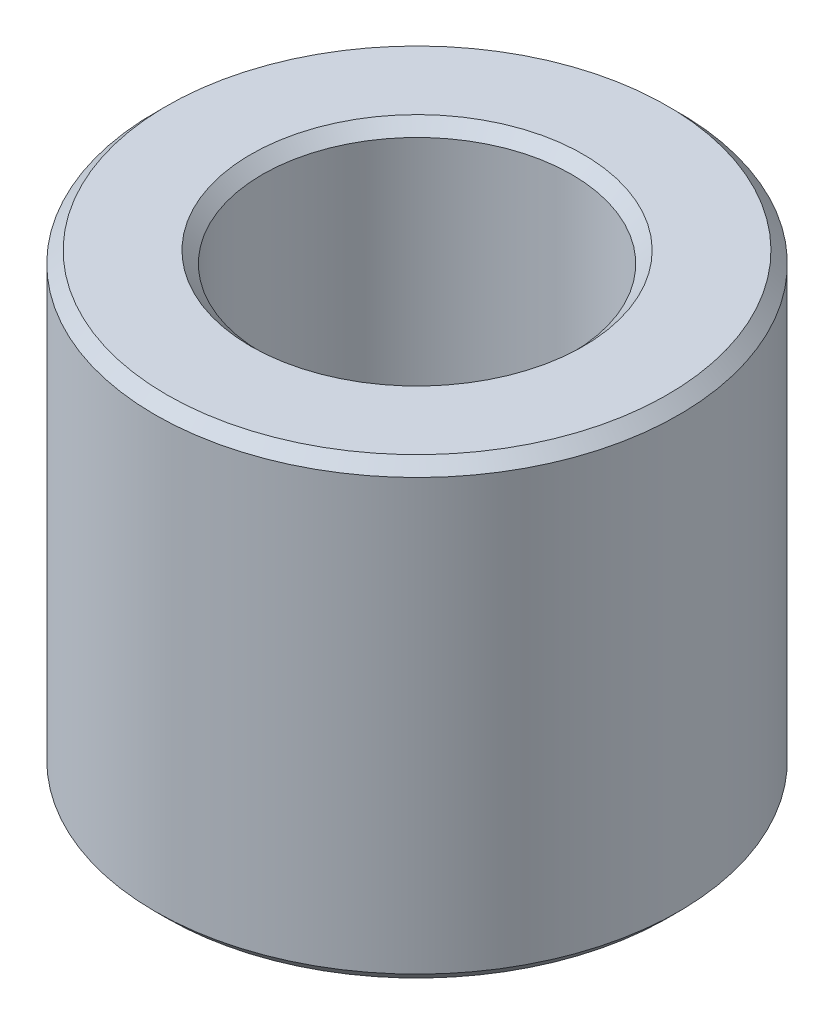
from build123d import *

# Parameters (mm, degrees)
SKETCH1_R           = 32.5
BOSS_EXTRUDE1_DEPTH = 56.25952605
SKETCH2_R           = 19.195184707
CUT_EXTRUDE1_DEPTH  = 73.64732804
CHAMFER1_SIZE       = 1.439562345


with BuildPart() as part:
    # Sketch1 → Boss-Extrude1 (new body)
    with BuildSketch(Plane(origin=(0, 0, 0), x_dir=(1, 0, 0), z_dir=(0, 1, 0))):
        Circle(SKETCH1_R)
    extrude(amount=BOSS_EXTRUDE1_DEPTH)

    # Sketch2 → Cut-Extrude1 (cut, through all)
    with BuildSketch(Plane(origin=(0, 0, 0), x_dir=(1, 0, 0), z_dir=(0, 1, 0))):
        Circle(SKETCH2_R)
    extrude(amount=CUT_EXTRUDE1_DEPTH, mode=Mode.SUBTRACT)

    # Chamfer1
    chamfer1_edges = [part.edges().sort_by_distance(p)[0] for p in [
        (-19.195184707, 56.25952605, 0),
        (-19.195184707, 0, 0),
        (-32.5, 0, 0),
        (-32.5, 56.25952605, 0),
    ]]
    chamfer(chamfer1_edges, length=CHAMFER1_SIZE)


solid = part.part
